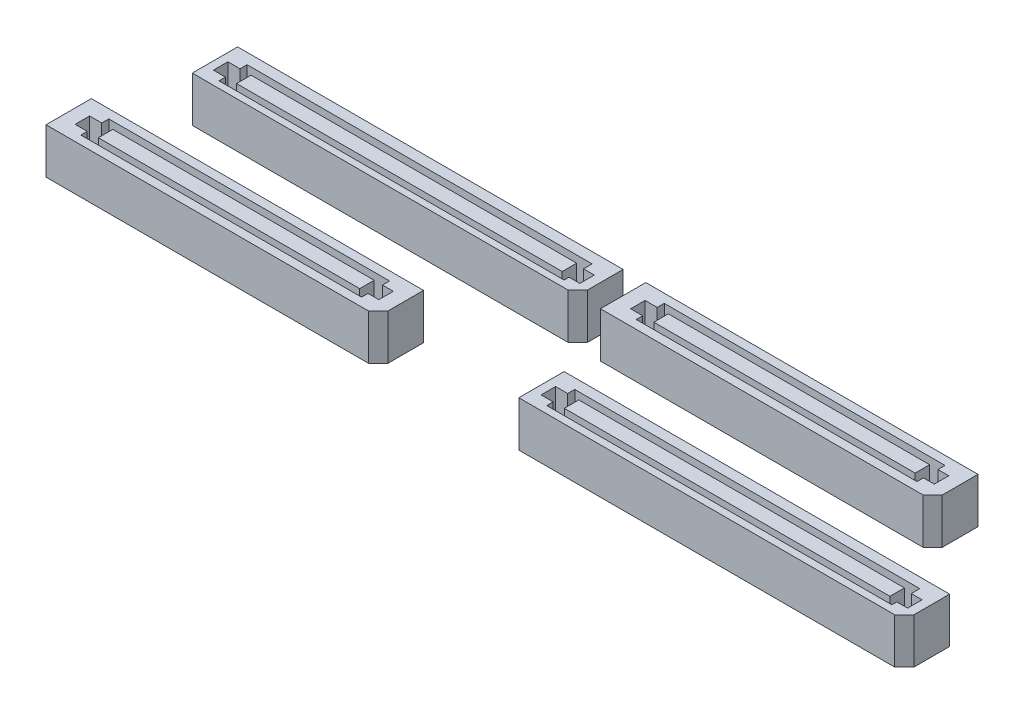
from build123d import *

# Parameters (mm, degrees)
SV_DEPTH           = 5
SV_2_DEPTH         = 5
SV_3_DEPTH         = 5
SV_4_DEPTH         = 5
SKETCH3_W          = 28.811718275
SKETCH3_H          = 1.597828601
SKETCH3_W_2        = 35.897762959
SKETCH3_W_3        = 35.897762958
CUT_EXTRUDE1_DEPTH = 4


with BuildPart() as part:
    # Sketch1 → SV (new body)
    with BuildSketch(Plane(origin=(0, 0, 0), x_dir=(1, 0, 0), z_dir=(0, 1, 0))):
        Polygon((55.811, 9.5), (97.25, 9.5), (97.25, 5.56), (96.19, 4.5), (54.75, 4.5), (54.75, 8.439), (54.75, 9.5), align=None)
    extrude(amount=SV_DEPTH)


with BuildPart() as body_2:
    # Sketch1 → SV 2 (new body)
    with BuildSketch(Plane(origin=(0, 0, 0), x_dir=(1, 0, 0), z_dir=(0, 1, 0))):
        Polygon((3.686, 9.5), (39.25, 9.5), (39.25, 5.555), (38.195, 4.5), (2.625, 4.5), (2.625, 8.439), (2.625, 9.5), align=None)
    extrude(amount=SV_2_DEPTH)


with BuildPart() as body_3:
    # Sketch1 → SV 3 (new body)
    with BuildSketch(Plane(origin=(0, 0, 0), x_dir=(1, 0, 0), z_dir=(0, 1, 0))):
        Polygon((51.811, 22.5), (87.375, 22.5), (87.375, 18.555), (86.32, 17.5), (50.75, 17.5), (50.75, 21.439), (50.75, 22.5), align=None)
    extrude(amount=SV_3_DEPTH)


with BuildPart() as body_4:
    # Sketch1 → SV 4 (new body)
    with BuildSketch(Plane(origin=(0, 0, 0), x_dir=(1, 0, 0), z_dir=(0, 1, 0))):
        Polygon((6.811, 22.5), (48.25, 22.5), (48.25, 18.56), (47.19, 17.5), (5.75, 17.5), (5.75, 21.439), (5.75, 22.5), align=None)
    extrude(amount=SV_4_DEPTH)


with BuildPart() as cut_extrude1_tool:
    # Sketch3 → Cut-Extrude1 (new body)
    # profile 1 of 4: a face of its own
    with BuildSketch(Plane(origin=(0, 5, 0), x_dir=(1, 0, 0), z_dir=(0, 1, 0))):
        Polygon((4.189336253, 7.745735487), (5.524337048, 7.745735487), (5.524337048, 8.524173538), (36.475691419, 8.524173538), (36.475691419, 7.745735487), (37.666991912, 7.745735487), (37.666991912, 6.147906886), (36.475691419, 6.147906886), (36.475691419, 5.438560322), (5.524337048, 5.438560322), (5.524337048, 6.147906886), (4.189336253, 6.147906886), align=None)
        with Locations((21.152985591, 6.946821187)):
            Rectangle(SKETCH3_W, SKETCH3_H, mode=Mode.SUBTRACT)
    # profile 2 of 4: a face of its own
    with BuildSketch(Plane(origin=(0, 5, 0), x_dir=(1, 0, 0), z_dir=(0, 1, 0))):
        Polygon((52.421116037, 20.753597434), (53.756116831, 20.753597434), (53.756116831, 21.532035485), (84.707471203, 21.532035485), (84.707471203, 20.753597434), (85.898771695, 20.753597434), (85.898771695, 19.155768833), (84.707471203, 19.155768833), (84.707471203, 18.446422269), (53.756116831, 18.446422269), (53.756116831, 19.155768833), (52.421116037, 19.155768833), align=None)
        with Locations((69.384765375, 19.954683133)):
            Rectangle(SKETCH3_W, SKETCH3_H, mode=Mode.SUBTRACT)
    # profile 3 of 4: a face of its own
    with BuildSketch(Plane(origin=(0, 5, 0), x_dir=(1, 0, 0), z_dir=(0, 1, 0))):
        Polygon((55.705906871, 7.599031898), (57.040907666, 7.599031898), (57.040907666, 8.377469948), (95.07830672, 8.377469948), (95.07830672, 7.437727621), (96.269607213, 7.437727621), (96.269607213, 5.83989902), (95.07830672, 5.83989902), (95.07830672, 5.291856733), (57.040907666, 5.291856733), (57.040907666, 6.001203297), (55.705906871, 6.001203297), align=None)
        with Locations((76.21257855, 6.800117597)):
            Rectangle(SKETCH3_W_2, SKETCH3_H, mode=Mode.SUBTRACT)
    # profile 4 of 4: a face of its own
    with BuildSketch(Plane(origin=(0, 5, 0), x_dir=(1, 0, 0), z_dir=(0, 1, 0))):
        Polygon((6.636601859, 20.53972103), (7.971602653, 20.53972103), (7.971602653, 21.318159081), (46.009001708, 21.318159081), (46.009001708, 20.378416754), (47.2003022, 20.378416754), (47.2003022, 18.780588153), (46.009001708, 18.780588153), (46.009001708, 18.232545866), (7.971602653, 18.232545866), (7.971602653, 18.941892429), (6.636601859, 18.941892429), align=None)
        with Locations((27.143273538, 19.74080673)):
            Rectangle(SKETCH3_W_3, SKETCH3_H, mode=Mode.SUBTRACT)
    extrude(amount=-CUT_EXTRUDE1_DEPTH)


with BuildPart() as part_1:
    add(part.part)

    # Cut-Extrude1: cut by cut_extrude1_tool
    add(cut_extrude1_tool.part, mode=Mode.SUBTRACT)


with BuildPart() as body_2_1:
    add(body_2.part)

    # Cut-Extrude1: cut by cut_extrude1_tool
    add(cut_extrude1_tool.part, mode=Mode.SUBTRACT)


with BuildPart() as body_3_1:
    add(body_3.part)

    # Cut-Extrude1: cut by cut_extrude1_tool
    add(cut_extrude1_tool.part, mode=Mode.SUBTRACT)


with BuildPart() as body_4_1:
    add(body_4.part)

    # Cut-Extrude1: cut by cut_extrude1_tool
    add(cut_extrude1_tool.part, mode=Mode.SUBTRACT)


solid = Compound([part_1.part, body_2_1.part, body_3_1.part, body_4_1.part])
